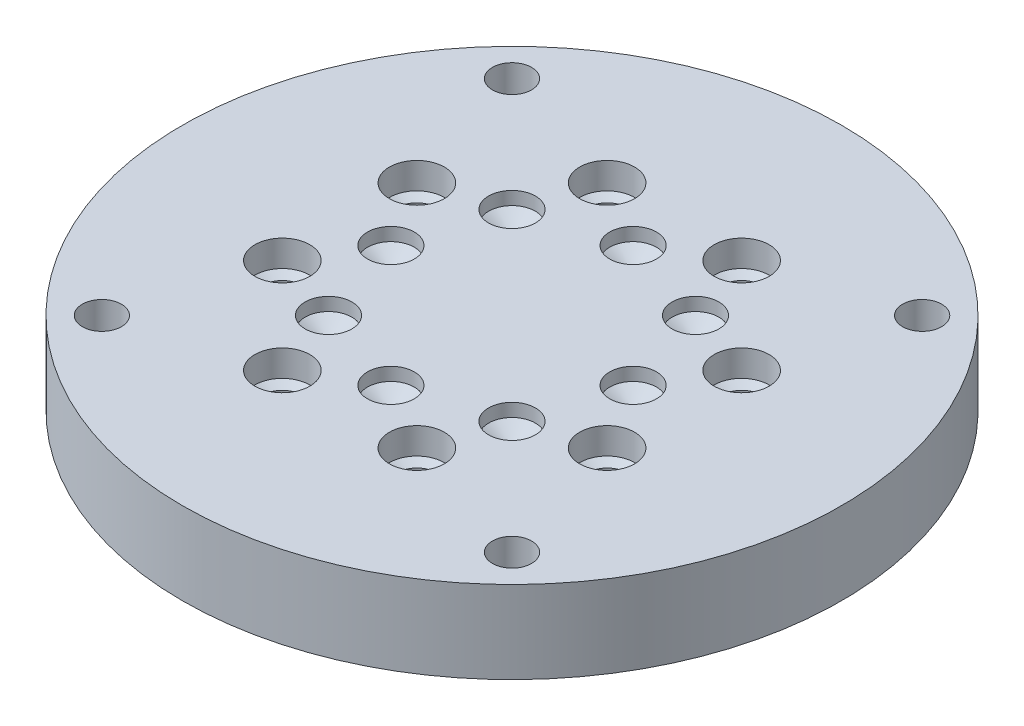
from build123d import *

# Parameters (mm, degrees)
OUTER_R                               = 19.05
BODY_DEPTH                            = 4.7625
F_4_40_TAPPED_HOLE_D                  = 2.2606
SCREW_HOLES_COUNT                     = 4
F_43_0_089_DIAMETER_HOLE1_D           = 2.2606
IO_HOLES_PATTERN_COUNT                = 8
F_36_0_1065_DIAMETER_HOLE1_AT_2_COUNT = 2
F_36_0_1065_DIAMETER_HOLE1_AT_2_PITCH = 5.568104507
POST_BOTTOMS_COUNT                    = 4


with BuildPart() as part:
    # outer → Body (new body)
    with BuildSketch(Plane(origin=(0, 0, 0), x_dir=(1, 0, 0), z_dir=(0, 1, 0))):
        Circle(OUTER_R)
    extrude(amount=-BODY_DEPTH)

    # #4-40 Tapped Hole (through all)
    with Locations(Plane(origin=(0, 0, 0), x_dir=(1, 0, 0), z_dir=(0, 1, 0))):
        with Locations((-11.85393808, 11.85393808)):
            f_4_40_tapped_hole = Hole(F_4_40_TAPPED_HOLE_D / 2)

    # Screw Holes: #4-40 Tapped Hole ×4 about axis
    screw_holes_axis = Axis((0, 0.15875, 0), (0, -1, 0))
    for i in range(1, SCREW_HOLES_COUNT):
        add(f_4_40_tapped_hole.rotate(screw_holes_axis, i * 360 / SCREW_HOLES_COUNT), mode=Mode.SUBTRACT)

    # #43 (0.089) Diameter Hole1 (through all)
    with Locations(Plane(origin=(0, 0, 0), x_dir=(1, 0, 0), z_dir=(0, 1, 0))):
        with Locations((-3.888063673, 9.38661605)):
            f_43_0_089_diameter_hole1 = Hole(F_43_0_089_DIAMETER_HOLE1_D / 2)

    # Sketch40 → 1/8 (0.125) Diameter Hole1 (revolve, cut)
    with BuildSketch(Plane(origin=(-3.888063673, 0, -9.38661605), x_dir=(0, 0, 1), z_dir=(1, 0, 0))):
        Polygon((0, 0), (0, 2.477866233), (1.5875, 1.524), (1.5875, 0), align=None)
    f_1_8_0_125_diameter_hole1 = revolve(axis=Axis((-3.888063673, 6.35, -9.38661605), (0, -1, 0)), mode=Mode.SUBTRACT)

    # Sketch42 → 1/8 (0.125) Diameter Hole2 (revolve, cut)
    with BuildSketch(Plane(origin=(-3.888063673, -4.7625, -9.38661605), x_dir=(0, 0, -1), z_dir=(1, 0, 0))):
        Polygon((0, 0), (0, 2.477866233), (1.5875, 1.524), (1.5875, 0), align=None)
    f_1_8_0_125_diameter_hole2 = revolve(axis=Axis((-3.888063673, -11.1125, -9.38661605), (0, 1, 0)), mode=Mode.SUBTRACT)

    # IO Holes Pattern: #43 (0.089) Diameter Hole1, 1/8 (0.125) Diameter Hole1, 1/8 (0.125) Diameter Hole2 ×8 about axis
    io_holes_pattern_axis = Axis((0, 0.15875, 0), (0, -1, 0))
    add([f_43_0_089_diameter_hole1.rotate(io_holes_pattern_axis, i * 360 / IO_HOLES_PATTERN_COUNT) for i in range(1, IO_HOLES_PATTERN_COUNT)], mode=Mode.SUBTRACT)
    add([f_1_8_0_125_diameter_hole1.rotate(io_holes_pattern_axis, i * 360 / IO_HOLES_PATTERN_COUNT) for i in range(1, IO_HOLES_PATTERN_COUNT)], mode=Mode.SUBTRACT)
    add([f_1_8_0_125_diameter_hole2.rotate(io_holes_pattern_axis, i * 360 / IO_HOLES_PATTERN_COUNT) for i in range(1, IO_HOLES_PATTERN_COUNT)], mode=Mode.SUBTRACT)

    # Sketch45 → #36 (0.1065) Diameter Hole1 (revolve, cut)
    with BuildSketch(Plane(origin=(0, 0, -6.99999997), x_dir=(0, 0, 1), z_dir=(1, 0, 0))):
        Polygon((0, 0), (0, 1.57469403), (1.35255, 0.762), (1.35255, 0), align=None)
    f_36_0_1065_diameter_hole1 = revolve(axis=Axis((0, 6.35, -6.99999997), (0, -1, 0)), mode=Mode.SUBTRACT)

    # #36 (0.1065) Diameter Hole1 at 2: #36 (0.1065) Diameter Hole1 ×2
    with Locations(*[Vector(-0.9524427643588189, 0, 0.30471754235772414) * (i * F_36_0_1065_DIAMETER_HOLE1_AT_2_PITCH) for i in range(1, F_36_0_1065_DIAMETER_HOLE1_AT_2_COUNT)]):
        add(f_36_0_1065_diameter_hole1, mode=Mode.SUBTRACT)

    # Post Bottoms: #36 (0.1065) Diameter Hole1 ×4 about axis
    post_bottoms_axis = Axis((0, 0.15875, 0), (0, -1, 0))
    for i in range(1, POST_BOTTOMS_COUNT):
        add(f_36_0_1065_diameter_hole1.rotate(post_bottoms_axis, i * 360 / POST_BOTTOMS_COUNT), mode=Mode.SUBTRACT)

    # Post Bottoms copy 1 sketch → Post Bottoms copy 1 (revolve, cut)
    with BuildSketch(Plane(origin=(5.303300849, 0, -5.303300849), x_dir=(-1, 0, 0), z_dir=(0, 0, 1))):
        Polygon((0, 0), (0, 1.57469403), (1.35255, 0.762), (1.35255, 0), align=None)
    revolve(axis=Axis((5.303300849, 6.35, -5.303300849), (0, -1, 0)), mode=Mode.SUBTRACT)

    # Post Bottoms copy 2 sketch → Post Bottoms copy 2 (revolve, cut)
    with BuildSketch(Plane(origin=(5.303300849, 0, 5.303300849), x_dir=(0, 0, -1), z_dir=(-1, 0, 0))):
        Polygon((0, 0), (0, 1.57469403), (1.35255, 0.762), (1.35255, 0), align=None)
    revolve(axis=Axis((5.303300849, 6.35, 5.303300849), (0, -1, 0)), mode=Mode.SUBTRACT)

    # Post Bottoms copy 3 sketch → Post Bottoms copy 3 (revolve, cut)
    with BuildSketch(Plane(origin=(-5.303300849, 0, 5.303300849), x_dir=(1, 0, 0), z_dir=(0, 0, -1))):
        Polygon((0, 0), (0, 1.57469403), (1.35255, 0.762), (1.35255, 0), align=None)
    revolve(axis=Axis((-5.303300849, 6.35, 5.303300849), (0, -1, 0)), mode=Mode.SUBTRACT)


solid = part.part
